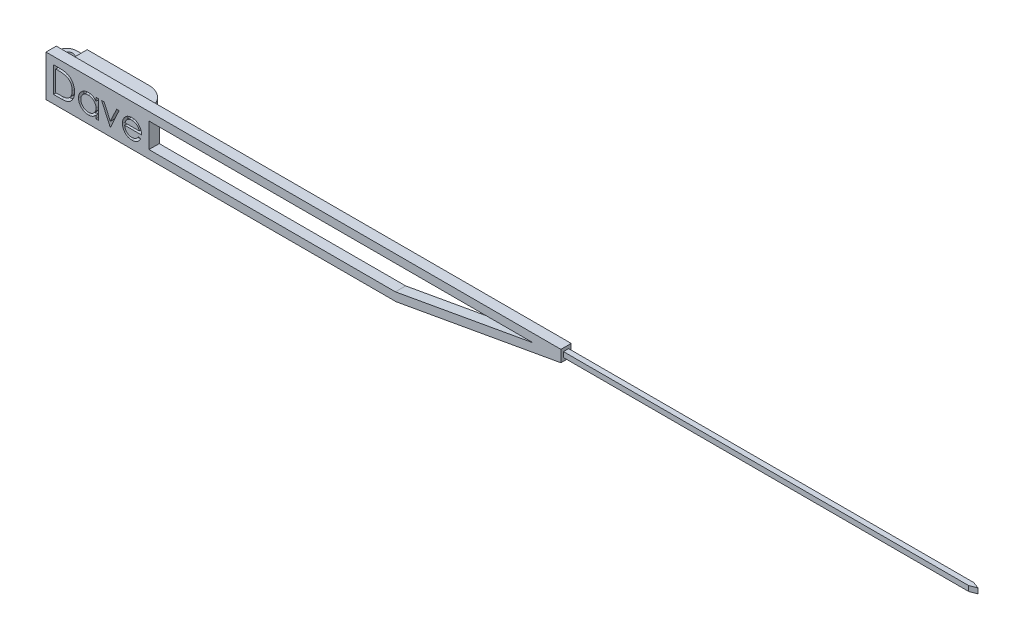
from build123d import *

# Parameters (mm, degrees)
BOSS_EXTRUDE1_DEPTH = 0.635
SKETCH4_W           = 0.635
SKETCH4_H           = 0.635
CUT_EXTRUDE2_DEPTH  = 115.335272335
SKETCH7_W           = 10.16
SKETCH7_H           = 3.048
BOSS_EXTRUDE2_DEPTH = 2.54
FILLET1_R           = 2.54
SKETCH9_W           = 2.54
SKETCH9_H           = 2.54
BOSS_EXTRUDE3_DEPTH = 0.635
CUT_EXTRUDE3_DEPTH  = 115.391755949
SKETCH11_R          = 0.762
CUT_EXTRUDE4_DEPTH  = 115.391755949
CUT_EXTRUDE5_DEPTH  = 0.635
CUT_EXTRUDE7_DEPTH  = 55.88


with BuildPart() as part:
    # Sketch1 → Boss-Extrude1 (new, symmetric)
    with BuildSketch(Plane.XY):
        Polygon((0, -2.54), (0, 2.54), (63.5, 2.54), (63.5, 1.100966908), (43.18, -2.54), align=None)
    extrude(amount=BOSS_EXTRUDE1_DEPTH, both=True)

    # Sweep1: sweep along a path in Sketch3
    with BuildLine(Plane.XY) as sweep1_path:
        Line((63.5, 1.820483454), (114.3, 1.820483454))
    # Sketch4 → Sweep1 (sweep)
    with BuildSketch(Plane(origin=(63.5, 0, 0), x_dir=(0, 0, -1), z_dir=(1, 0, 0))):
        with Locations((0, 1.820483454)):
            Rectangle(SKETCH4_W, SKETCH4_H)
    sweep(path=sweep1_path.line)

    # Sketch5 → Cut-Extrude2 (cut, through all)
    with BuildSketch(Plane.XY.offset(0.635)):
        Polygon((12.7, 1.524), (12.7, -1.524), (43.089694934, -1.524), (60.100385107, 1.524), align=None)
    extrude(amount=-CUT_EXTRUDE2_DEPTH, mode=Mode.SUBTRACT)

    # Sketch7 → Boss-Extrude2 (add)
    with BuildSketch(Plane(origin=(0, 0, -0.635), x_dir=(-1, 0, 0), z_dir=(0, 0, -1))):
        with Locations((-6.35, 0)):
            Rectangle(SKETCH7_W, SKETCH7_H)
    extrude(amount=BOSS_EXTRUDE2_DEPTH)

    # Fillet1
    fillet1_edges = [part.edges().sort_by_distance(p)[0] for p in [
        (11.43, 0, -3.175),
    ]]
    fillet(fillet1_edges, radius=FILLET1_R - 0.0001)  # a hair under: the kernel refuses the full size

    # Sketch9 → Boss-Extrude3 (add, symmetric)
    with BuildSketch(Plane(origin=(0, 0.127, 0), x_dir=(1, 0, 0), z_dir=(0, 1, 0))):
        with Locations((0, 1.905)):
            Rectangle(SKETCH9_W, SKETCH9_H)
    extrude(amount=BOSS_EXTRUDE3_DEPTH, both=True)

    # Sketch10 → Cut-Extrude3 (cut, through all)
    with BuildSketch(Plane(origin=(0, 0.762, 0), x_dir=(1, 0, 0), z_dir=(0, 1, 0))):
        with BuildLine():
            ThreePointArc((-1.27, 1.904999998), (-0.898025613, 2.803025611), (0, 3.175))
            Line((0, 3.175), (-1.27, 3.175))
            Line((-1.27, 3.175), (-1.27, 1.904999998))
        make_face()
        with BuildLine():
            ThreePointArc((0, 0.635), (-0.898025611, 1.006974387), (-1.27, 1.904999998))
            Line((-1.27, 1.904999998), (-1.27, 0.635))
            Line((-1.27, 0.635), (0, 0.635))
        make_face()
    extrude(amount=-CUT_EXTRUDE3_DEPTH, mode=Mode.SUBTRACT)

    # Sketch11 → Cut-Extrude4 (cut, through all)
    with BuildSketch(Plane(origin=(0, 0.762, 0), x_dir=(1, 0, 0), z_dir=(0, 1, 0))):
        with Locations(Location((0, 1.905, 0), (0, 0, 270))):
            Circle(SKETCH11_R)
    extrude(amount=-CUT_EXTRUDE4_DEPTH, mode=Mode.SUBTRACT)

    # Sketch12 → Cut-Extrude5 (cut)
    # profile 1 of 4: a face of its own
    with BuildSketch(Plane.XY.offset(0.635)):
        with BuildLine():
            Line((0.915051282, -1.524), (0.915051282, 1.651))
            Line((0.915051282, 1.651), (1.556157051, 1.651))
            add(Edge.make_bspline(
                [(1.556157051, 1.651), (1.611918205, 1.650598526), (1.719648463, 1.64982288), (1.875325469, 1.644904903), (2.019365025, 1.636204981), (2.151293405, 1.623532625), (2.27147279, 1.607972373), (2.37956667, 1.588468435), (2.476133971, 1.565437737), (2.535524106, 1.545802222), (2.563608974, 1.536516827)],
                knots=[0, 0, 0, 0, 1.314313732, 2.53924729, 3.670748893, 4.714932338, 5.66265055, 6.526160246, 7.303039223, 8, 8, 8, 8], degree=3))
            add(Edge.make_bspline(
                [(2.563608974, 1.536516827), (2.600343488, 1.522518973), (2.672979498, 1.494840689), (2.776400245, 1.442628901), (2.873759681, 1.383471302), (2.965579906, 1.317289912), (3.049763512, 1.242210824), (3.129599247, 1.161423325), (3.201821175, 1.071989617), (3.267959415, 0.975764449), (3.327591049, 0.873881373), (3.379424428, 0.766534524), (3.422471979, 0.654269057), (3.458207263, 0.537397173), (3.486370836, 0.415661887), (3.505585874, 0.288921452), (3.518259557, 0.157676758), (3.519533232, 0.068618495), (3.520179487, 0.023430889)],
                knots=[0, 0, 0, 0, 0.984719456, 1.947108742, 2.898477687, 3.838006223, 4.779231079, 5.722358779, 6.681677486, 7.655904652, 8.64651281, 9.637519902, 10.640069247, 11.656948941, 12.698408672, 13.768548281, 14.867775369, 16, 16, 16, 16], degree=3))
            add(Edge.make_bspline(
                [(3.520179487, 0.023430889), (3.519608924, -0.015813234), (3.518484569, -0.093147878), (3.50838869, -0.207122119), (3.493714457, -0.317715145), (3.470995791, -0.424400316), (3.443416368, -0.528112342), (3.408070317, -0.627745878), (3.367579545, -0.724214905), (3.32036287, -0.816215044), (3.268527471, -0.903376388), (3.212899889, -0.985541332), (3.153539458, -1.061537426), (3.089880134, -1.13159481), (3.022744563, -1.19560787), (2.951693206, -1.254111341), (2.876542724, -1.305960502), (2.797629711, -1.353192807), (2.71265208, -1.394395558), (2.620000258, -1.429257067), (2.519279118, -1.458146497), (2.410735886, -1.482250095), (2.294183017, -1.501370219), (2.169506241, -1.514184875), (2.036897114, -1.52285075), (1.94583878, -1.523609478), (1.898970553, -1.524)],
                knots=[0, 0, 0, 0, 1.105936401, 2.179363191, 3.223086493, 4.248585256, 5.251745608, 6.245858792, 7.225916811, 8.198733463, 9.158002045, 10.082870192, 10.993790845, 11.873723703, 12.748670949, 13.606408763, 14.465103618, 15.319838547, 16.196477973, 17.123216899, 18.106603292, 19.147568657, 20.255746949, 21.433717677, 22.679120308, 24, 24, 24, 24], degree=3))
            Line((1.898970553, -1.524), (0.915051282, -1.524))
        make_face()
        with BuildLine():
            Line((1.199987179, -1.198358974), (1.56442528, -1.198358974))
            add(Edge.make_bspline(
                [(1.56442528, -1.198358974), (1.61679316, -1.198133916), (1.71751577, -1.197701045), (1.862348381, -1.193902653), (1.994681834, -1.187696039), (2.114534917, -1.179010075), (2.221839961, -1.167517832), (2.31682122, -1.154704527), (2.399167347, -1.138741125), (2.448996193, -1.124271326), (2.472022436, -1.117584736)],
                knots=[0, 0, 0, 0, 1.375205317, 2.645023457, 3.804390687, 4.853969522, 5.800190428, 6.637939096, 7.370582563, 8, 8, 8, 8], degree=3))
            add(Edge.make_bspline(
                [(2.472022436, -1.117584736), (2.501004164, -1.107377965), (2.558275393, -1.087208212), (2.640717521, -1.050416619), (2.717604232, -1.006835599), (2.790275469, -0.958392108), (2.857700364, -0.90337752), (2.920677955, -0.842988123), (2.979081446, -0.776916577), (3.032307426, -0.705244888), (3.079939959, -0.628419144), (3.121188859, -0.547194631), (3.157339892, -0.46246131), (3.185714044, -0.372918002), (3.207953181, -0.279365213), (3.223705433, -0.181796363), (3.233515933, -0.080229671), (3.234660247, -0.011148816), (3.23524359, 0.024066907)],
                knots=[0, 0, 0, 0, 0.998632004, 1.973411704, 2.929992603, 3.868527914, 4.809262121, 5.754881198, 6.702106254, 7.672490631, 8.653608572, 9.636854334, 10.631411391, 11.644891563, 12.686317036, 13.754757253, 14.855430412, 16, 16, 16, 16], degree=3))
            add(Edge.make_bspline(
                [(3.23524359, 0.024066907), (3.234777965, 0.061199421), (3.23386324, 0.134146574), (3.22236583, 0.241180991), (3.205564133, 0.344124152), (3.181267504, 0.442982944), (3.150305921, 0.537950235), (3.111666496, 0.62850079), (3.06751892, 0.715590921), (3.014992322, 0.797210525), (2.957465319, 0.874402131), (2.893622528, 0.945118376), (2.824478251, 1.009520348), (2.750786637, 1.06861101), (2.67047084, 1.120013059), (2.585422849, 1.16599312), (2.49439499, 1.205014678), (2.431064902, 1.225769075), (2.398880409, 1.236316506)],
                knots=[0, 0, 0, 0, 1.122418816, 2.205001699, 3.251619955, 4.274784885, 5.280384055, 6.268708349, 7.249350384, 8.229342522, 9.199999885, 10.157847722, 11.105861043, 12.055065948, 13.010012805, 13.98527497, 14.976112212, 16, 16, 16, 16], degree=3))
            add(Edge.make_bspline(
                [(2.398880409, 1.236316506), (2.372254726, 1.243679266), (2.315641219, 1.259334513), (2.223258277, 1.276411815), (2.119285962, 1.291474468), (2.003262662, 1.304227118), (1.875320631, 1.313377759), (1.735361472, 1.320246023), (1.583324687, 1.324878468), (1.477930532, 1.325194796), (1.423229367, 1.325358974)],
                knots=[0, 0, 0, 0, 0.674548936, 1.434276114, 2.292660221, 3.240891867, 4.284742987, 5.42552168, 6.663806718, 8, 8, 8, 8], degree=3))
            Line((1.423229367, 1.325358974), (1.199987179, 1.325358974))
            Line((1.199987179, 1.325358974), (1.199987179, -1.198358974))
        make_face(mode=Mode.SUBTRACT)
    # profile 2 of 4: a face of its own
    with BuildSketch(Plane.XY.offset(0.635)):
        with BuildLine():
            Line((6.450948718, 0.796192308), (6.450948718, -1.524))
            Line((6.450948718, -1.524), (6.166012821, -1.524))
            Line((6.166012821, -1.524), (6.166012821, -1.122672877))
            add(Edge.make_bspline(
                [(6.166012821, -1.122672877), (6.133882918, -1.158994508), (6.071181008, -1.229876629), (5.966459422, -1.322479743), (5.855454004, -1.399022934), (5.73870352, -1.460844644), (5.616313399, -1.507283152), (5.488554948, -1.540290596), (5.355376053, -1.561512147), (5.264432845, -1.563631252), (5.218346554, -1.564705128)],
                knots=[0, 0, 0, 0, 1.074387032, 2.096679803, 3.090159297, 4.057316773, 5.018401886, 5.985159533, 6.978961417, 8, 8, 8, 8], degree=3))
            add(Edge.make_bspline(
                [(5.218346554, -1.564705128), (5.177372768, -1.563592633), (5.096570646, -1.561398744), (4.977708555, -1.544378655), (4.863324871, -1.517045876), (4.753311509, -1.479035784), (4.648380349, -1.428616038), (4.547632975, -1.368253621), (4.451591319, -1.296370868), (4.36171928, -1.214194585), (4.278958822, -1.124936275), (4.206331811, -1.029735672), (4.145777231, -0.929004439), (4.095140444, -0.824017935), (4.056136617, -0.713967972), (4.028946249, -0.599235113), (4.011945986, -0.479955013), (4.009753004, -0.398729874), (4.008641026, -0.35754367)],
                knots=[0, 0, 0, 0, 1.033919861, 2.038935746, 3.024066025, 3.998881131, 4.97069526, 5.957263378, 6.95902576, 7.993208707, 9.027059324, 10.027763471, 11.009749337, 11.988697705, 12.965288445, 13.950418724, 14.960734635, 16, 16, 16, 16], degree=3))
            add(Edge.make_bspline(
                [(4.008641026, -0.35754367), (4.00977765, -0.317208739), (4.012024694, -0.237468756), (4.028764401, -0.120194508), (4.056913959, -0.007238658), (4.096418077, 0.101035141), (4.147074708, 0.204757901), (4.208695187, 0.30400298), (4.281283964, 0.399043791), (4.364970076, 0.487645547), (4.455625189, 0.569488533), (4.552606681, 0.640616738), (4.653502086, 0.702045594), (4.759876389, 0.750716962), (4.870155119, 0.790095221), (4.985320031, 0.817339413), (5.104891963, 0.833393412), (5.186072624, 0.835718205), (5.227250801, 0.836897436)],
                knots=[0, 0, 0, 0, 1.020392517, 2.01726096, 2.990465484, 3.961182959, 4.928053699, 5.906110375, 6.912531644, 7.948652711, 8.985773172, 9.998621852, 10.987621588, 11.969261332, 12.953316658, 13.946091881, 14.958173133, 16, 16, 16, 16], degree=3))
            add(Edge.make_bspline(
                [(5.227250801, 0.836897436), (5.274603531, 0.83559319), (5.367459998, 0.833035625), (5.503284692, 0.811751579), (5.631776468, 0.775793827), (5.753927202, 0.726882954), (5.869298253, 0.661887321), (5.976797389, 0.579899785), (6.077549649, 0.481437423), (6.13595177, 0.405808519), (6.166012821, 0.366880409)],
                knots=[0, 0, 0, 0, 1.038897134, 2.037228247, 3.008116434, 3.962042015, 4.918381754, 5.904844433, 6.921570401, 8, 8, 8, 8], degree=3))
            Line((6.166012821, 0.366880409), (6.166012821, 0.796192308))
            Line((6.166012821, 0.796192308), (6.450948718, 0.796192308))
        make_face()
        with BuildLine():
            add(Edge.make_bspline(
                [(5.231066907, 0.551961538), (5.189416043, 0.550479596), (5.107203863, 0.547554476), (4.986513947, 0.52471852), (4.871022493, 0.486723209), (4.761307126, 0.434760342), (4.659100958, 0.369419988), (4.567757414, 0.290388447), (4.486529392, 0.199822013), (4.418214038, 0.098129384), (4.362524087, -0.010889313), (4.323365422, -0.124848624), (4.297539748, -0.24169314), (4.294901304, -0.320943576), (4.293576923, -0.360723758)],
                knots=[0, 0, 0, 0, 1.031046209, 2.035121221, 3.029706178, 4.034933723, 5.034054252, 6.02443088, 7.017295772, 8.038157696, 9.050218397, 10.03989886, 11.016116709, 12, 12, 12, 12], degree=3))
            add(Edge.make_bspline(
                [(4.293576923, -0.360723758), (4.295268648, -0.400266212), (4.298645466, -0.479196128), (4.322912167, -0.596199937), (4.363624624, -0.710186104), (4.419179924, -0.820187148), (4.488745648, -0.92231701), (4.569380354, -1.014609836), (4.661863823, -1.093975391), (4.764305205, -1.160412333), (4.873713864, -1.214081191), (4.988770359, -1.251424307), (5.10731183, -1.275534151), (5.18791359, -1.278350355), (5.228522837, -1.279769231)],
                knots=[0, 0, 0, 0, 0.979072187, 1.954306742, 2.945804271, 3.96968567, 4.997920485, 5.998718438, 6.996577872, 8.005894225, 9.015743152, 10.005417472, 10.995077863, 12, 12, 12, 12], degree=3))
            add(Edge.make_bspline(
                [(5.228522837, -1.279769231), (5.269749307, -1.278263406), (5.351744668, -1.275268471), (5.472792638, -1.252334752), (5.590263069, -1.214444485), (5.702555769, -1.161921705), (5.807163974, -1.096827533), (5.901051334, -1.0206211), (5.98044082, -0.931990354), (6.047744115, -0.834584572), (6.100517529, -0.727802975), (6.138958668, -0.614106959), (6.16168614, -0.493492566), (6.164550652, -0.411066004), (6.166012821, -0.368991987)],
                knots=[0, 0, 0, 0, 1.01762866, 2.023962475, 3.030623092, 4.058876274, 5.077231937, 6.066672613, 7.034107872, 8.005628644, 8.981990164, 9.965428785, 10.961468474, 12, 12, 12, 12], degree=3))
            add(Edge.make_bspline(
                [(6.166012821, -0.368991987), (6.165142275, -0.336935527), (6.163428766, -0.273838268), (6.150338178, -0.18119402), (6.129514781, -0.092535568), (6.100172184, -0.0077697), (6.061626518, 0.072634921), (6.015137474, 0.149255618), (5.95988753, 0.221693888), (5.896766084, 0.288952245), (5.827673365, 0.350299107), (5.754562603, 0.405058097), (5.676567597, 0.450042198), (5.594999999, 0.487272494), (5.509718288, 0.516899009), (5.420028512, 0.53666356), (5.326884002, 0.550234708), (5.263342223, 0.551379868), (5.231066907, 0.551961538)],
                knots=[0, 0, 0, 0, 1.050140795, 2.067009409, 3.05949893, 4.030605086, 5.00011959, 5.97591094, 6.962425594, 7.979863591, 8.993523472, 9.986985069, 10.967611495, 11.937549037, 12.921786183, 13.919465291, 14.943216303, 16, 16, 16, 16], degree=3))
        make_face(mode=Mode.SUBTRACT)
    # profile 3 of 4: a face of its own
    with BuildSketch(Plane.XY.offset(0.635)):
        Polygon((6.858, 0.796192308), (7.16646855, 0.796192308), (7.936685897, -0.893070513), (8.706903245, 0.796192308), (9.015371795, 0.796192308), (7.957038462, -1.524), (7.916333333, -1.524), align=None)
    # profile 4 of 4: a face of its own
    with BuildSketch(Plane.XY.offset(0.635)):
        with BuildLine():
            Line((11.408070112, -0.791307692), (11.661205128, -0.924235377))
            add(Edge.make_bspline(
                [(11.661205128, -0.924235377), (11.64103336, -0.960016113), (11.601787086, -1.029631256), (11.534294979, -1.125273015), (11.463545028, -1.211313443), (11.386343571, -1.285453915), (11.305000362, -1.3500891), (11.219064311, -1.406638413), (11.128088026, -1.454824499), (11.032067205, -1.495421435), (10.930195469, -1.526635762), (10.822225951, -1.548683162), (10.707951808, -1.562311413), (10.629623488, -1.563894505), (10.589515425, -1.564705128)],
                knots=[0, 0, 0, 0, 1.120438281, 2.179929193, 3.190490725, 4.156257408, 5.095198341, 6.022838206, 6.959905092, 7.901321166, 8.864066838, 9.862729781, 10.905609505, 12, 12, 12, 12], degree=3))
            add(Edge.make_bspline(
                [(10.589515425, -1.564705128), (10.544936631, -1.563664476), (10.457976318, -1.561634466), (10.331393834, -1.544133445), (10.212213933, -1.515583519), (10.100443316, -1.475700492), (9.996355701, -1.423605705), (9.899744211, -1.360142461), (9.810100784, -1.285636773), (9.730250252, -1.199443285), (9.65836473, -1.107203224), (9.594932021, -1.0110861), (9.54190278, -0.911333746), (9.49876577, -0.8085812), (9.463927071, -0.703476096), (9.439645847, -0.595062122), (9.425648861, -0.483632699), (9.423503971, -0.408251545), (9.422423077, -0.370264022)],
                knots=[0, 0, 0, 0, 1.145258523, 2.234067595, 3.276747158, 4.290159414, 5.277019952, 6.260822364, 7.254936242, 8.264827045, 9.274100331, 10.257902744, 11.220704747, 12.172965371, 13.118907548, 14.062713208, 15.023725156, 16, 16, 16, 16], degree=3))
            add(Edge.make_bspline(
                [(9.422423077, -0.370264022), (9.423383869, -0.334617998), (9.425288033, -0.263972284), (9.437290248, -0.159409969), (9.458561199, -0.057784158), (9.487749722, 0.040989591), (9.525442638, 0.136745898), (9.571554722, 0.229543042), (9.626157808, 0.319282276), (9.668315162, 0.375890833), (9.689550481, 0.404405449)],
                knots=[0, 0, 0, 0, 1.024358464, 2.0301432, 3.019427413, 4.004406732, 4.986367066, 5.972626655, 6.978780325, 8, 8, 8, 8], degree=3))
            add(Edge.make_bspline(
                [(9.689550481, 0.404405449), (9.718313879, 0.438757924), (9.774929523, 0.506374674), (9.870684217, 0.595218727), (9.974370824, 0.669644152), (10.084689942, 0.73133634), (10.202923743, 0.778211719), (10.327482886, 0.813143598), (10.459785667, 0.832717936), (10.550232546, 0.835482757), (10.596511619, 0.836897436)],
                knots=[0, 0, 0, 0, 1.030682036, 2.02871468, 2.997146059, 3.962720338, 4.930598197, 5.918074684, 6.934738563, 8, 8, 8, 8], degree=3))
            add(Edge.make_bspline(
                [(10.596511619, 0.836897436), (10.644089089, 0.83566912), (10.737425241, 0.833259445), (10.873525808, 0.810919842), (11.002304458, 0.775493596), (11.123709658, 0.725461229), (11.237753717, 0.66090935), (11.343695348, 0.580952108), (11.443346363, 0.488044272), (11.501320574, 0.416594789), (11.530821514, 0.380236779)],
                knots=[0, 0, 0, 0, 1.056321875, 2.072262726, 3.055038591, 4.01806755, 4.982017516, 5.957941055, 6.960871419, 8, 8, 8, 8], degree=3))
            add(Edge.make_bspline(
                [(11.530821514, 0.380236779), (11.550893808, 0.352837816), (11.590904789, 0.298222265), (11.641021802, 0.209167001), (11.68452601, 0.115993819), (11.719299482, 0.017196621), (11.747456743, -0.086053998), (11.767828286, -0.194496164), (11.779775012, -0.308097583), (11.78212333, -0.385500958), (11.783320513, -0.424961538)],
                knots=[0, 0, 0, 0, 0.94817472, 1.890038105, 2.849395472, 3.817997239, 4.812318967, 5.836947057, 6.897266129, 8, 8, 8, 8], degree=3))
            Line((11.783320513, -0.424961538), (9.707358974, -0.424961538))
            add(Edge.make_bspline(
                [(9.707358974, -0.424961538), (9.708755617, -0.455532674), (9.711502059, -0.515649579), (9.724306511, -0.603615932), (9.744489327, -0.687411749), (9.772854834, -0.766408509), (9.807205472, -0.841637982), (9.849283944, -0.912542115), (9.899484825, -0.978797952), (9.955478852, -1.040998141), (10.017806003, -1.096388974), (10.083376781, -1.145965943), (10.153130229, -1.187518163), (10.226516347, -1.221245634), (10.303416467, -1.247649221), (10.383854815, -1.265672172), (10.467673106, -1.277743619), (10.524810165, -1.279085887), (10.553898438, -1.279769231)],
                knots=[0, 0, 0, 0, 1.094153842, 2.151609401, 3.174256925, 4.172055639, 5.149267565, 6.128595816, 7.11444997, 8.118368179, 9.117203808, 10.09244225, 11.054858984, 12.015122123, 12.976791628, 13.957293641, 14.960065497, 16, 16, 16, 16], degree=3))
            add(Edge.make_bspline(
                [(10.553898438, -1.279769231), (10.582338407, -1.279217637), (10.638768762, -1.278123168), (10.722807254, -1.267480649), (10.805483826, -1.250271898), (10.886456289, -1.226785979), (10.964081271, -1.198141263), (11.035968305, -1.163576528), (11.102081073, -1.125340686), (11.163872892, -1.081607624), (11.223808722, -1.028078769), (11.28326512, -0.96128065), (11.347016084, -0.882279821), (11.386920929, -0.822820539), (11.408070112, -0.791307692)],
                knots=[0, 0, 0, 0, 0.99110716, 1.966546729, 2.947904876, 3.932708344, 4.903319531, 5.828989031, 6.710028674, 7.56322171, 8.463672341, 9.504779593, 10.677557249, 12, 12, 12, 12], degree=3))
        make_face()
        with BuildLine():
            add(Edge.make_bspline(
                [(11.498384615, -0.140025641), (11.487955535, -0.102231463), (11.467882911, -0.029489835), (11.425939923, 0.071240115), (11.378703597, 0.16076414), (11.322803884, 0.238397092), (11.259468325, 0.307343136), (11.186311624, 0.367594282), (11.104273349, 0.421494398), (11.013777557, 0.466989879), (10.917945367, 0.50571568), (10.81760975, 0.531682749), (10.715231613, 0.549471405), (10.645985511, 0.551127947), (10.611140024, 0.551961538)],
                knots=[0, 0, 0, 0, 1.154881502, 2.222775134, 3.210006277, 4.132804581, 5.035138423, 5.962687519, 6.919655026, 7.923214229, 8.944639381, 9.960483929, 10.97369054, 12, 12, 12, 12], degree=3))
            add(Edge.make_bspline(
                [(10.611140024, 0.551961538), (10.582701605, 0.551406665), (10.526484829, 0.550309797), (10.443661717, 0.539904751), (10.364123704, 0.522705463), (10.287283908, 0.499151538), (10.214149263, 0.467756592), (10.143215437, 0.430941807), (10.076286078, 0.386000514), (10.034429331, 0.351747838), (10.013283454, 0.33444351)],
                knots=[0, 0, 0, 0, 1.04873581, 2.073130211, 3.073294108, 4.04793562, 5.032784715, 6.005352987, 6.992311501, 8, 8, 8, 8], degree=3))
            add(Edge.make_bspline(
                [(10.013283454, 0.33444351), (9.998140262, 0.320750809), (9.967494133, 0.29304012), (9.926545231, 0.245297911), (9.887338088, 0.193816137), (9.851656846, 0.136625203), (9.818929321, 0.074376353), (9.788304199, 0.007594641), (9.760739383, -0.064226698), (9.745230768, -0.114275983), (9.737251803, -0.140025641)],
                knots=[0, 0, 0, 0, 0.879870761, 1.780643979, 2.707998968, 3.669668524, 4.684282772, 5.740141944, 6.837334558, 8, 8, 8, 8], degree=3))
            Line((9.737251803, -0.140025641), (11.498384615, -0.140025641))
        make_face(mode=Mode.SUBTRACT)
    extrude(amount=-CUT_EXTRUDE5_DEPTH, mode=Mode.SUBTRACT)

    # Sketch14 → Cut-Extrude7 (cut)
    with BuildSketch(Plane(origin=(0, 2.137983454, 0), x_dir=(1, 0, 0), z_dir=(0, 1, 0))):
        Polygon((114.3, -0.3175), (114.3, 0), (113.469629751, -0.3175), align=None)
        Polygon((113.469629751, 0.3175), (114.3, 0), (114.3, 0.3175), align=None)
    extrude(amount=-CUT_EXTRUDE7_DEPTH, mode=Mode.SUBTRACT)


solid = part.part
